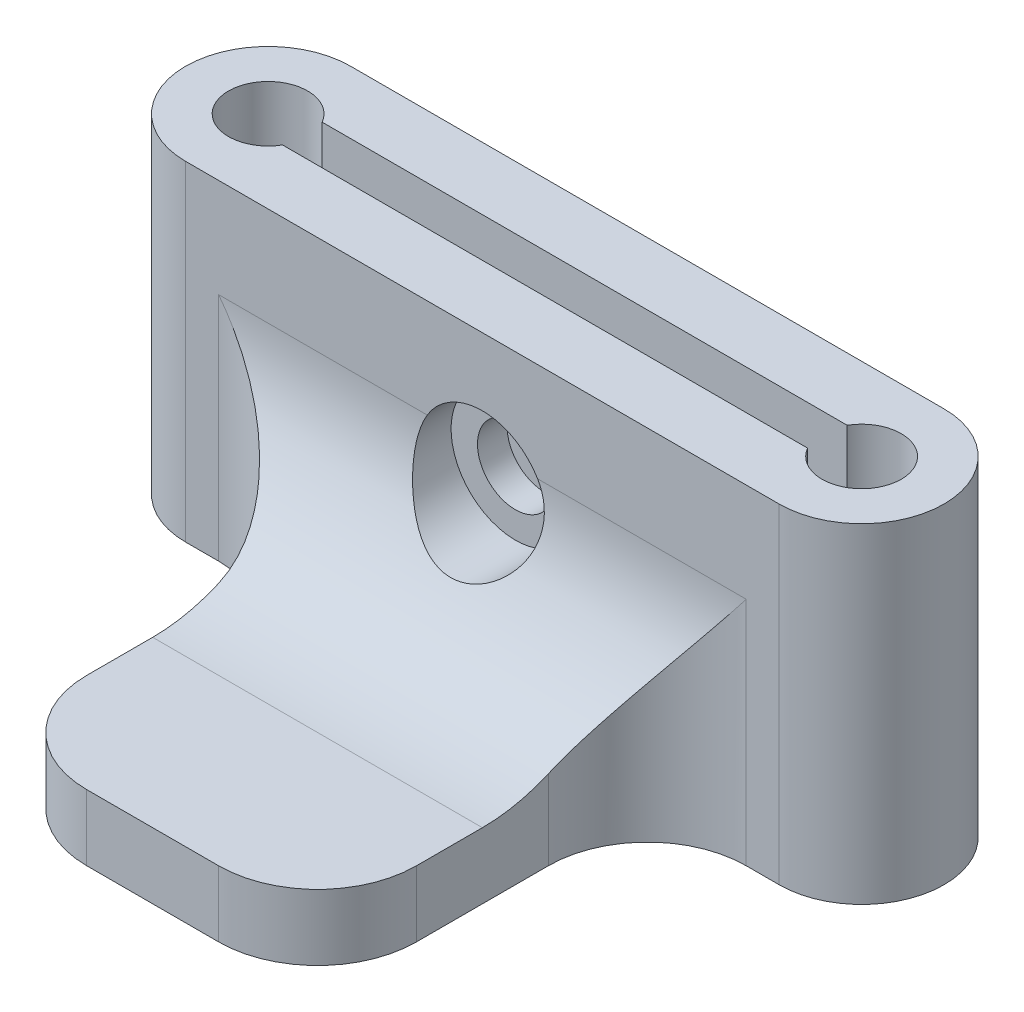
from build123d import *

# Parameters (mm, degrees)
SKETCH_1_R               = 1.2
EXTRUDE_1_DEPTH          = 10
SKETCH_3_W               = 10
SKETCH_3_H               = 15
EXTRUDE_2_DEPTH          = 2
FILLET_2_R               = 3
FILLET_START             = -5
FILLET_3_DEPTH           = 10
FILLET_START_2           = 2
FILLET_3_2_DEPTH         = 4.9438
FILLET_START_3           = -9
FILLET_3_3_DEPTH         = 17
SKETCH_4_W               = 15.92154
SKETCH_4_H               = 1.2
CUT_EXTRUDE_2_DEPTH      = 20.710403
CUT_EXTRUDE_4_DEPTH      = 19.227726
CUT_EXTRUDE_4_DEPTH_BACK = 1
SKETCH_6_R               = 1.95
SKETCH_7_R               = 1.15
CUT_EXTRUDE_5_DEPTH      = 19.794946
CUT_EXTRUDE_6_DEPTH      = 1


with BuildPart() as part:
    # 草图1 → 凸台-拉伸1 (new body)
    with BuildSketch(Plane(origin=(0, 0, 0), x_dir=(1, 0, 0), z_dir=(0, 1, 0))):
        with BuildLine():
            Line((-9, 2.5), (9, 2.5))
            ThreePointArc((9, 2.5), (11.5, 0), (9, -2.5))
            Line((9, -2.5), (-9, -2.5))
            ThreePointArc((-9, -2.5), (-11.5, 0), (-9, 2.5))
        make_face()
        with Locations(Location((9, 0, 0), (0, 0, 270))):
            Circle(SKETCH_1_R, mode=Mode.SUBTRACT)
        with Locations(Location((-9, 0, 0), (0, 0, 90))):
            Circle(SKETCH_1_R, mode=Mode.SUBTRACT)
    extrude(amount=EXTRUDE_1_DEPTH)

    # 草图3 → 凸台-拉伸2 (add)
    with BuildSketch(Plane.XZ):
        with Locations((0, 5)):
            Rectangle(SKETCH_3_W, SKETCH_3_H)
    extrude(amount=-EXTRUDE_2_DEPTH)

    # 圆角2
    fillet_2_edges = [part.edges().sort_by_distance(p)[0] for p in [
        (5, 1, 12.5),
        (5, 1, 2.5),
        (-5, 1, 2.5),
        (-5, 1, 12.5),
    ]]
    fillet(fillet_2_edges, radius=FILLET_2_R)

    # 圆角3: read off the stored shape, not the designer's step
    # 圆角3 outline → 圆角3 (add)
    with BuildSketch(Plane.YZ.offset(FILLET_START)):
        with BuildLine():
            ThreePointArc((7, 2.5), (3.464466, 3.964466), (2, 7.5))
            Line((2, 7.5), (2, 2.5))
            Line((2, 2.5), (7, 2.5))
        make_face()
    extrude(amount=FILLET_3_DEPTH)

    # Fillet 3 2 outline → Fillet 3 2 (add)
    with BuildSketch(Plane(origin=(0, 0, 0), x_dir=(1, 0, 0), z_dir=(0, 1, 0)).offset(FILLET_START_2)):
        with BuildLine():
            Line((5, -2.5), (5, -5.5))
            ThreePointArc((5, -5.5), (5.87868, -3.37868), (8, -2.5))
            Line((8, -2.5), (5, -2.5))
        make_face()
        with BuildLine():
            Line((-5, -5.5), (-5, -2.5))
            Line((-5, -2.5), (-8, -2.5))
            ThreePointArc((-8, -2.5), (-5.87868, -3.37868), (-5, -5.5))
        make_face()
    extrude(amount=FILLET_3_2_DEPTH)

    # Fillet 3 3 outline → Fillet 3 3 (cut)
    with BuildSketch(Plane.YZ.offset(FILLET_START_3)):
        with BuildLine():
            Line((8, 7), (2.025063, 7))
            ThreePointArc((2.025063, 7), (3.625111, 3.81081), (6.9438, 2.500316))
            ThreePointArc((6.9438, 2.500316), (6.9719, 2.500079), (7, 2.5))
            Line((7, 2.5), (8, 2.5))
            Line((8, 2.5), (8, 7))
        make_face()
    extrude(amount=FILLET_3_3_DEPTH, mode=Mode.SUBTRACT)

    # 草图4 → 切除-拉伸2 (cut, through all)
    with BuildSketch(Plane.XZ):
        Rectangle(SKETCH_4_W, SKETCH_4_H)
    extrude(amount=-CUT_EXTRUDE_2_DEPTH, mode=Mode.SUBTRACT)

    # 草图6 → 切除-拉伸4 (cut, two sides: drawn at the far end of the back side and taken through both)
    with BuildSketch(Plane.XY.offset(2.5).offset(-CUT_EXTRUDE_4_DEPTH_BACK)):
        with Locations(Location((0, 6, 0), (0, 0, 149.148114))):
            Circle(SKETCH_6_R)
    extrude(amount=CUT_EXTRUDE_4_DEPTH + CUT_EXTRUDE_4_DEPTH_BACK, mode=Mode.SUBTRACT)

    # 草图7 → 切除-拉伸5 (cut, through all)
    with BuildSketch(Plane.XY.offset(1.5)):
        with Locations((0, 6)):
            Circle(SKETCH_7_R)
    extrude(amount=-CUT_EXTRUDE_5_DEPTH, mode=Mode.SUBTRACT)

    # 草图8 → 切除-拉伸6 (cut)
    with BuildSketch(Plane(origin=(0, 0, -2.5), x_dir=(-1, 0, 0), z_dir=(0, 0, -1))):
        Polygon((0, 8.424871), (-2.1, 7.212436), (-2.1, 4.787564), (0, 3.575129), (2.1, 4.787564), (2.1, 7.212436), align=None)
    extrude(amount=-CUT_EXTRUDE_6_DEPTH, mode=Mode.SUBTRACT)


solid = part.part
